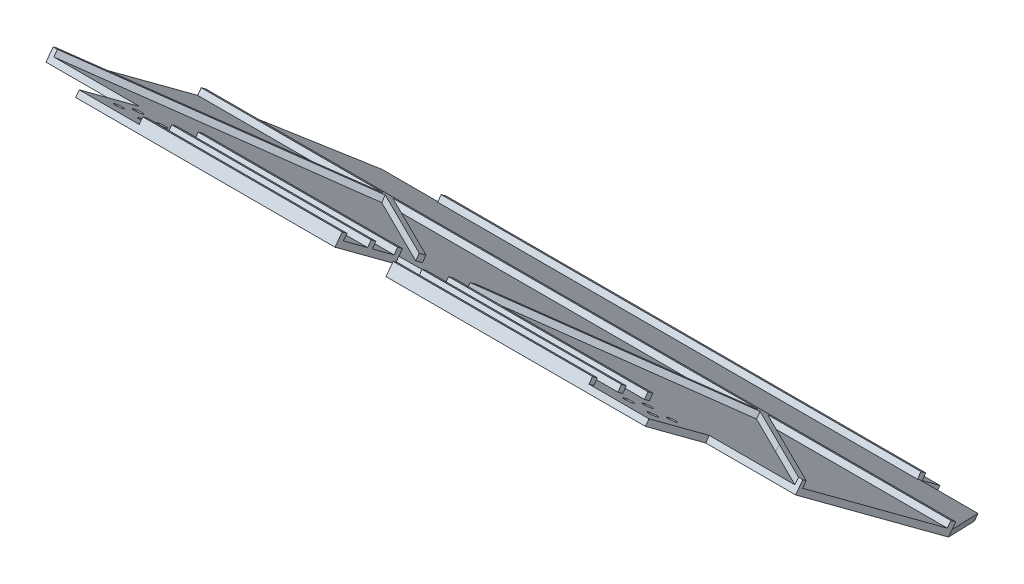
from build123d import *

# Parameters (mm, degrees)
SHELL_2_T            = -3
SKETCH_4_R           = 1.5
CUT_EXTRUDE_1_DEPTH  = 10
EXTRUDE_1_DEPTH      = 40.5
SKETCH_7_R           = 1.51
CUT_EXTRUDE_2_DEPTH  = 100
SKETCH_8_R           = 1.5
EXTRUDE_2_DEPTH      = 3
EXTRUDE_3_DEPTH      = 4
SKETCH_11_W          = 56.2
SKETCH_11_H          = 25
CUT_EXTRUDE_3_DEPTH  = 4
SKETCH_12_W          = 3
SKETCH_12_H          = 215
EXTRUDE_5_DEPTH      = 10
SKETCH_13_W          = 10
SKETCH_13_H          = 215
CUT_EXTRUDE_4_DEPTH  = 300
SKETCH_15_W          = 116.702064096
SKETCH_15_H          = 65.174269722
SKETCH_15_W_2        = 111.85
SKETCH_15_H_2        = 80
CUT_EXTRUDE_5_DEPTH  = 4
EXTRUDE_6_DEPTH      = 4
SKETCH_17_W          = 56.2
SKETCH_17_H          = 25
CUT_EXTRUDE_6_DEPTH  = 4
EXTRUDE_7_DEPTH      = 4
SKETCH_20_R          = 1.5
CUT_EXTRUDE_7_DEPTH  = 10
SKETCH_21_W          = 185
SKETCH_21_H          = 185
CUT_EXTRUDE_8_DEPTH  = 37.5
EXTRUDE_START        = 1
SKETCH_22_W          = 185
SKETCH_22_H          = 185
SKETCH_22_R          = 1.5
EXTRUDE_8_DEPTH      = 1
CUT_EXTRUDE_START    = -2
SKETCH_24_R          = 3
SKETCH_24_R_2        = 1.5
CUT_EXTRUDE_9_DEPTH  = 2
SKETCH_25_R          = 1.51
CUT_EXTRUDE_10_DEPTH = 10
SKETCH_26_R          = 1.5
EXTRUDE_9_DEPTH      = 4
EXTRUDE_START_2      = -4
SKETCH_28_R          = 3
EXTRUDE_10_DEPTH     = 4
SKETCH_29_R          = 3
CUT_EXTRUDE_11_DEPTH = 2
SKETCH_30_W          = 20
SKETCH_30_H          = 20
EXTRUDE_11_DEPTH     = 300
EXTRUDE_11_2_DEPTH   = 300
EXTRUDE_11_3_DEPTH   = 300
EXTRUDE_11_4_DEPTH   = 300
SKETCH_31_W          = 20
SKETCH_31_H          = 20
EXTRUDE_12_DEPTH     = 300
EXTRUDE_13_DEPTH     = 2
EXTRUDE_14_DEPTH     = 2
SKETCH_34_W          = 360
SKETCH_34_H          = 2
EXTRUDE_15_DEPTH     = 40
CUT_EXTRUDE_12_DEPTH = 400
SKETCH_36_W          = 360
SKETCH_36_H          = 35.328815684
CUT_EXTRUDE_13_DEPTH = 1
SKETCH_38_W          = 80
SKETCH_38_H          = 33.975155378
CUT_EXTRUDE_16_DEPTH = 3
SKETCH_40_R          = 1.5
CUT_EXTRUDE_17_DEPTH = 3
CUT_EXTRUDE_18_DEPTH = 3
SKETCH_42_W          = 20
SKETCH_42_H          = 20
SKETCH_42_W_2        = 200
SKETCH_42_H_2        = 194.4594667
CUT_EXTRUDE_19_DEPTH = 1000
SKETCH_43_W          = 200
SKETCH_43_H          = 10.011542291
CUT_EXTRUDE_20_DEPTH = 1000
SKETCH_44_W          = 5
SKETCH_44_H          = 25
CUT_EXTRUDE_21_DEPTH = 5
SKETCH_46_W          = 190
SKETCH_46_H          = 2
EXTRUDE_16_DEPTH     = 2
SKETCH_47_W          = 20
SKETCH_47_H          = 25
CUT_EXTRUDE_22_DEPTH = 2
SKETCH_48_W          = 250
SKETCH_48_H          = 2
EXTRUDE_17_DEPTH     = 2
EXTRUDE_18_DEPTH     = 2
CUT_EXTRUDE_23_DEPTH = 10
CUT_EXTRUDE_24_DEPTH = 10
CUT_EXTRUDE_25_DEPTH = 2
CUT_EXTRUDE_26_DEPTH = 2


with BuildPart() as part:
    # 草图3 → 放样1 section 0
    with BuildSketch(Plane.XY.offset(20)):
        with BuildLine():
            Line((-32.460246779, 32.274755465), (182.539753221, 32.274755465))
            Line((182.539753221, 32.274755465), (182.539753221, -182.725244535))
            Line((182.539753221, -182.725244535), (-32.460246779, -182.725244535))
            Line((-32.460246779, -182.725244535), (-32.460246779, 32.274755465))
        make_face()
    # 草图1 → 放样1 section 1
    with BuildSketch(Plane.XY):
        with BuildLine():
            Line((-17.5, -167.5), (167.5, -167.5))
            Line((167.5, -167.5), (167.5, 17.5))
            Line((167.5, 17.5), (-17.5, 17.5))
            Line((-17.5, 17.5), (-17.5, -167.5))
        make_face()
    loft()

    # 抽壳2
    shell_2_openings = [part.faces().sort_by_distance(p)[0] for p in [
        (75.039753221, -75.225244535, 20),
    ]]
    offset(amount=SHELL_2_T, openings=shell_2_openings, kind=Kind.INTERSECTION)

    # 草图4 → 切除-拉伸1 (cut)
    with BuildSketch(Plane.XY.offset(3)):
        with Locations((47.75, -75.225244535)):
            Circle(SKETCH_4_R)
        with Locations((84.75, -75.225244535)):
            Circle(SKETCH_4_R)
        with Locations((73.25, -75.225244535)):
            Circle(SKETCH_4_R)
        with Locations((59.25, -75.225244535)):
            Circle(SKETCH_4_R)
        with Locations((66.25, -68.225244535)):
            Circle(SKETCH_4_R)
        with Locations((66.25, -82.225244535)):
            Circle(SKETCH_4_R)
    extrude(amount=-CUT_EXTRUDE_1_DEPTH, mode=Mode.SUBTRACT)

    # 草图6 → 凸台-拉伸1 (add)
    with BuildSketch(Plane.XY.offset(3)):
        Polygon((38.15, -62.5), (34.15, -62.5), (31.15, -62.5), (31.15, -65.5), (34.15, -65.5), (34.15, -84.5), (31.15, -84.5), (31.15, -87.5), (34.15, -87.5), (38.15, -87.5), (38.15, -75), align=None)
        Polygon((94.35, -75), (94.35, -62.5), (98.35, -62.5), (101.35, -62.5), (101.35, -65.5), (98.35, -65.5), (98.35, -84.5), (101.35, -84.5), (101.35, -87.5), (98.35, -87.5), (94.35, -87.5), align=None)
    extrude(amount=-EXTRUDE_1_DEPTH)

    # 草图7 → 切除-拉伸2 (cut)
    with BuildSketch(Plane(origin=(98.35, 0, 0), x_dir=(0, 0, -1), z_dir=(1, 0, 0))):
        with Locations((16.5, -75)):
            Circle(SKETCH_7_R)
        with Locations((33.5, -75)):
            Circle(SKETCH_7_R)
    extrude(amount=-CUT_EXTRUDE_2_DEPTH, mode=Mode.SUBTRACT)

    # 草图8 → 凸台-拉伸2 (add)
    with BuildSketch(Plane.XY.offset(3)):
        with Locations((66.25, -68.225244535)):
            Circle(SKETCH_8_R)
        with Locations((59.25, -75.225244535)):
            Circle(SKETCH_8_R)
        with Locations((47.75, -75.225244535)):
            Circle(SKETCH_8_R)
        with Locations((73.25, -75.225244535)):
            Circle(SKETCH_8_R)
        with Locations((84.75, -75.225244535)):
            Circle(SKETCH_8_R)
        with Locations((66.25, -82.225244535)):
            Circle(SKETCH_8_R)
    extrude(amount=-EXTRUDE_2_DEPTH)

    # 草图9 → 凸台-拉伸3 (add)
    with BuildSketch(Plane(origin=(0, 0, 0), x_dir=(-1, 0, 0), z_dir=(0, 0, -1))):
        Polygon((-73.585786438, -76.414213562), (0, -2.828427125), (0, 0), (-2.828427125, 0), (-72.748638048, -69.920210924), (-150, -147.171572875), (-150, -150), (-147.171572875, -150), align=None)
    extrude(amount=EXTRUDE_3_DEPTH)

    # 草图11 → 切除-拉伸3 (cut)
    with BuildSketch(Plane(origin=(0, 0, -4), x_dir=(-1, 0, 0), z_dir=(0, 0, -1))):
        with Locations((-66.25, -75)):
            Rectangle(SKETCH_11_W, SKETCH_11_H)
    extrude(amount=-CUT_EXTRUDE_3_DEPTH, mode=Mode.SUBTRACT)


with BuildPart() as body_2:
    # 草图12 → 凸台-拉伸5 (new body)
    with BuildSketch(Plane.XY.offset(20)):
        with Locations((184.039753221, -75.225244535)):
            Rectangle(SKETCH_12_W, SKETCH_12_H)
    extrude(amount=-EXTRUDE_5_DEPTH)


with BuildPart() as cut_extrude_4_tool:
    # 草图13 → 切除-拉伸4 (new body)
    with BuildSketch(Plane(origin=(185.539753221, 0, 0), x_dir=(0, 0, -1), z_dir=(1, 0, 0))):
        with Locations((-15, -75.225244535)):
            Rectangle(SKETCH_13_W, SKETCH_13_H)
    extrude(amount=-CUT_EXTRUDE_4_DEPTH)


with BuildPart() as part_1:
    add(part.part)

    # 切除-拉伸4: cut by cut_extrude_4_tool
    add(cut_extrude_4_tool.part, mode=Mode.SUBTRACT)

    # 草图15 → 切除-拉伸5 (cut)
    with BuildSketch(Plane(origin=(0, 0, -4), x_dir=(-1, 0, 0), z_dir=(0, 0, -1))):
        with Locations((-96.501032048, -120.087134861)):
            Rectangle(SKETCH_15_W, SKETCH_15_H)
        with Locations((-38.425, -22.5)):
            Rectangle(SKETCH_15_W_2, SKETCH_15_H_2)
    extrude(amount=-CUT_EXTRUDE_5_DEPTH, mode=Mode.SUBTRACT)

    # 草图16 → 凸台-拉伸6 (add)
    with BuildSketch(Plane(origin=(0, 0, 0), x_dir=(-1, 0, 0), z_dir=(0, 0, -1))):
        Polygon((-77.828427125, -75), (-167.5, -164.671572875), (-167.5, -167.5), (-164.671572875, -167.5), (-75, -77.828427125), (14.671572875, -167.5), (17.5, -167.5), (17.5, -164.671572875), (-72.171572875, -75), (17.5, 14.671572875), (17.5, 17.5), (14.671572875, 17.5), (-75, -72.171572875), (-164.671572875, 17.5), (-167.5, 17.5), (-167.5, 14.671572875), align=None)
    extrude(amount=EXTRUDE_6_DEPTH)

    # 草图17 → 切除-拉伸6 (cut)
    with BuildSketch(Plane(origin=(0, 0, 0), x_dir=(-1, 0, 0), z_dir=(0, 0, -1))):
        with Locations((-66.25, -75)):
            Rectangle(SKETCH_17_W, SKETCH_17_H)
    extrude(amount=CUT_EXTRUDE_6_DEPTH, mode=Mode.SUBTRACT)

    # 草图18 → 凸台-拉伸7 (add)
    with BuildSketch(Plane(origin=(0, 0, 0), x_dir=(-1, 0, 0), z_dir=(0, 0, -1))):
        Polygon((-75, -119.25), (-33.578427125, -119.25), (-31.578427125, -121.25), (-29.578427125, -123.25), (-75, -123.25), (-120.421572875, -123.25), (-116.421572875, -119.25), align=None)
        Polygon((-119.25, -75), (-119.25, -116.421572875), (-121.25, -118.421572875), (-123.25, -120.421572875), (-123.25, -75), (-123.25, -29.578427125), (-119.25, -33.578427125), align=None)
        Polygon((-75, -30.75), (-116.421572875, -30.75), (-120.421572875, -26.75), (-75, -26.75), (-29.578427125, -26.75), (-33.578427125, -30.75), align=None)
        Polygon((-30.75, -33.578427125), (-26.75, -29.578427125), (-26.75, -75), (-26.75, -120.421572875), (-30.75, -116.421572875), (-30.75, -75), align=None)
    extrude(amount=EXTRUDE_7_DEPTH)

    # 草图20 → 切除-拉伸7 (cut)
    with BuildSketch(Plane(origin=(0, 0, 0), x_dir=(-1, 0, 0), z_dir=(0, 0, -1))):
        with Locations((-66.25, -82)):
            Circle(SKETCH_20_R)
        with Locations((-47.75, -75)):
            Circle(SKETCH_20_R)
        with Locations((-84.75, -75)):
            Circle(SKETCH_20_R)
        with Locations((-66.25, -68)):
            Circle(SKETCH_20_R)
    extrude(amount=-CUT_EXTRUDE_7_DEPTH, mode=Mode.SUBTRACT)

    # 草图21 → 切除-拉伸8 (cut)
    with BuildSketch(Plane(origin=(0, 0, -37.5), x_dir=(-1, 0, 0), z_dir=(0, 0, -1))):
        with Locations((-75, -75)):
            Rectangle(SKETCH_21_W, SKETCH_21_H)
    extrude(amount=-CUT_EXTRUDE_8_DEPTH, mode=Mode.SUBTRACT)

    # 草图22 → 凸台-拉伸8 (add)
    with BuildSketch(Plane(origin=(0, 0, 0), x_dir=(-1, 0, 0), z_dir=(0, 0, -1)).offset(EXTRUDE_START)):
        with Locations((-75, -75)):
            Rectangle(SKETCH_22_W, SKETCH_22_H)
        with Locations((-66.25, -68)):
            Circle(SKETCH_22_R, mode=Mode.SUBTRACT)
        with Locations((-66.25, -82)):
            Circle(SKETCH_22_R, mode=Mode.SUBTRACT)
        with Locations((-84.75, -75)):
            Circle(SKETCH_22_R, mode=Mode.SUBTRACT)
        with Locations((-47.75, -75)):
            Circle(SKETCH_22_R, mode=Mode.SUBTRACT)
    extrude(amount=-EXTRUDE_8_DEPTH)

    # 草图24 → 切除-拉伸9 (cut)
    # profile 1 of 4: a face of its own
    with BuildSketch(Plane.XY.offset(3).offset(CUT_EXTRUDE_START)):
        with Locations((66.25, -68)):
            Circle(SKETCH_24_R)
        with Locations((66.25, -68)):
            Circle(SKETCH_24_R_2, mode=Mode.SUBTRACT)
    # profile 2 of 4: a face of its own
    with BuildSketch(Plane.XY.offset(3).offset(CUT_EXTRUDE_START)):
        with Locations((66.25, -82)):
            Circle(SKETCH_24_R)
        with Locations((66.25, -82)):
            Circle(SKETCH_24_R_2, mode=Mode.SUBTRACT)
    # profile 3 of 4: a face of its own
    with BuildSketch(Plane.XY.offset(3).offset(CUT_EXTRUDE_START)):
        with Locations((47.75, -75)):
            Circle(SKETCH_24_R)
    # profile 4 of 4: a face of its own
    with BuildSketch(Plane.XY.offset(3).offset(CUT_EXTRUDE_START)):
        with Locations((84.75, -75)):
            Circle(SKETCH_24_R)
        with Locations((84.75, -75)):
            Circle(SKETCH_24_R_2, mode=Mode.SUBTRACT)
    extrude(amount=CUT_EXTRUDE_9_DEPTH, mode=Mode.SUBTRACT)

    # 草图25 → 切除-拉伸10 (cut)
    with BuildSketch(Plane(origin=(0, 0, -1), x_dir=(-1, 0, 0), z_dir=(0, 0, -1))):
        with Locations((-75, -68)):
            Circle(SKETCH_25_R)
        with Locations((-75, -82)):
            Circle(SKETCH_25_R)
        with Locations((-56.5, -75)):
            Circle(SKETCH_25_R)
        with Locations((-93.5, -75)):
            Circle(SKETCH_25_R)
    extrude(amount=-CUT_EXTRUDE_10_DEPTH, mode=Mode.SUBTRACT)

    # 草图26 → 凸台-拉伸9 (add)
    with BuildSketch(Plane(origin=(0, 0, -1), x_dir=(-1, 0, 0), z_dir=(0, 0, -1))):
        with Locations((-84.75, -75)):
            Circle(SKETCH_26_R)
        with Locations((-66.25, -68)):
            Circle(SKETCH_26_R)
        with Locations((-66.25, -82)):
            Circle(SKETCH_26_R)
        with Locations((-47.75, -75)):
            Circle(SKETCH_26_R)
    extrude(amount=-EXTRUDE_9_DEPTH)

    # 草图28 → 凸台-拉伸10 (add)
    with BuildSketch(Plane.XY.offset(3).offset(EXTRUDE_START_2)):
        with Locations((84.75, -75)):
            Circle(SKETCH_28_R)
        with Locations((66.25, -68)):
            Circle(SKETCH_28_R)
        with Locations((47.75, -75)):
            Circle(SKETCH_28_R)
        with Locations((66.25, -82)):
            Circle(SKETCH_28_R)
    extrude(amount=EXTRUDE_10_DEPTH)

    # 草图29 → 切除-拉伸11 (cut)
    with BuildSketch(Plane.XY.offset(3)):
        with Locations((75, -68)):
            Circle(SKETCH_29_R)
        with Locations((75, -82)):
            Circle(SKETCH_29_R)
        with Locations((93.5, -75)):
            Circle(SKETCH_29_R)
        with Locations((56.5, -75)):
            Circle(SKETCH_29_R)
    extrude(amount=-CUT_EXTRUDE_11_DEPTH, mode=Mode.SUBTRACT)

    # 草图32 → 凸台-拉伸13 (add)
    with BuildSketch(Plane(origin=(0, 11.321485901, -8.363609284), x_dir=(1, 0, 0), z_dir=(0, 0.804327079908719, -0.5941867959871823))):
        Polygon((-24.98012339, -22.831022035), (-19.370030847, -13.506457206), (169.379969153, -13.506457206), (175.01987661, -22.831022035), (255.01987661, -155.799450038), (-104.98012339, -155.799450038), align=None)
    extrude(amount=EXTRUDE_13_DEPTH)

    # 草图33 → 凸台-拉伸14 (add)
    with BuildSketch(Plane(origin=(0, 12.930140061, -9.551982876), x_dir=(1, 0, 0), z_dir=(0, 0.8043270799087189, -0.5941867959871823))):
        Polygon((-24.98012339, -22.831022035), (175.01987661, -22.831022035), (173.810188531, -20.831022035), (170.159993158, -20.831022035), (-23.776830229, -20.831022035), align=None)
    extrude(amount=EXTRUDE_14_DEPTH)



with BuildPart() as body_2_1:
    add(body_2.part)

    # 切除-拉伸4: cut by cut_extrude_4_tool
    add(cut_extrude_4_tool.part, mode=Mode.SUBTRACT)


with BuildPart() as body_2_2:
    # 草图30 → 凸台-拉伸11 (new body)
    with BuildSketch(Plane.XY.offset(10)):
        with Locations((-114.98012339, 114.887377733)):
            Rectangle(SKETCH_30_W, SKETCH_30_H)
    extrude(amount=EXTRUDE_11_DEPTH)



with BuildPart() as body_3:
    # 草图30 → Extrude 11 2 (new body)
    with BuildSketch(Plane.XY.offset(10)):
        with Locations((265.01987661, 114.887377733)):
            Rectangle(SKETCH_30_W, SKETCH_30_H)
    extrude(amount=EXTRUDE_11_2_DEPTH)


with BuildPart() as body_4:
    # 草图30 → Extrude 11 3 (new body)
    with BuildSketch(Plane.XY.offset(10)):
        with Locations((-114.98012339, -265.112622267)):
            Rectangle(SKETCH_30_W, SKETCH_30_H)
    extrude(amount=EXTRUDE_11_3_DEPTH)


with BuildPart() as body_5:
    # 草图30 → Extrude 11 4 (new body)
    with BuildSketch(Plane.XY.offset(10)):
        with Locations((265.01987661, -265.112622267)):
            Rectangle(SKETCH_30_W, SKETCH_30_H)
    extrude(amount=EXTRUDE_11_4_DEPTH)


with BuildPart() as body_2_2_1:
    add(body_2_2.part)

    add(body_3.part)  # 凸台-拉伸12 merges body 3

    add(body_4.part)  # 凸台-拉伸12 merges body 4

    add(body_5.part)  # 凸台-拉伸12 merges body 5
    # 草图31 → 凸台-拉伸12 (add)
    with BuildSketch(Plane(origin=(0, 0, 10), x_dir=(-1, 0, 0), z_dir=(0, 0, -1))):
        with Locations((-265.01987661, 114.887377733)):
            Rectangle(SKETCH_31_W, SKETCH_31_H)
        with Locations((114.98012339, 114.887377733)):
            Rectangle(SKETCH_31_W, SKETCH_31_H)
        with Locations((114.98012339, -265.112622267)):
            Rectangle(SKETCH_31_W, SKETCH_31_H)
        with Locations((-265.01987661, -265.112622267)):
            Rectangle(SKETCH_31_W, SKETCH_31_H)
    extrude(amount=EXTRUDE_12_DEPTH)


with BuildPart() as part_2:
    add(part_1.part)

    add(body_2_2_1.part)  # 凸台-拉伸15 merges body 2 2
    # 草图34 → 凸台-拉伸15 (add)
    with BuildSketch(Plane(origin=(0, 92.573976034, 125.3137167), x_dir=(1, 0, 0), z_dir=(0, 0.5941867959871824, 0.8043270799087189))):
        with Locations((75.01987661, 15.075723898)):
            Rectangle(SKETCH_34_W, SKETCH_34_H)
    extrude(amount=EXTRUDE_15_DEPTH)

    # 草图35 → 切除-拉伸12 (cut)
    with BuildSketch(Plane(origin=(255.01987661, 0, 0), x_dir=(0, 0, -1), z_dir=(1, 0, 0))):
        Polygon((-149.123190612, 127.662933775), (-145.366030572, 124.887377733), (-142.000085698, 124.887377733), (-147.93481702, 129.271587935), align=None)
    extrude(amount=-CUT_EXTRUDE_12_DEPTH, mode=Mode.SUBTRACT)

    # 草图36 → 切除-拉伸13 (cut)
    with BuildSketch(Plane(origin=(0, 11.321485901, -8.363609284), x_dir=(1, 0, 0), z_dir=(0, -0.8043270799087189, 0.5941867959871824))):
        with Locations((75.01987661, 173.46385788)):
            Rectangle(SKETCH_36_W, SKETCH_36_H)
    extrude(amount=-CUT_EXTRUDE_13_DEPTH, mode=Mode.SUBTRACT)

    # 草图38 → 切除-拉伸16 (cut)
    with BuildSketch(Plane(origin=(0, 12.930140061, -9.551982876), x_dir=(1, 0, 0), z_dir=(0, 0.8043270799087189, -0.5941867959871824))):
        with Locations((-64.98012339, -172.787027727)):
            Rectangle(SKETCH_38_W, SKETCH_38_H)
        with Locations((215.01987661, -172.787027727)):
            Rectangle(SKETCH_38_W, SKETCH_38_H)
    extrude(amount=-CUT_EXTRUDE_16_DEPTH, mode=Mode.SUBTRACT)

    # 草图40 → 切除-拉伸17 (cut)
    with BuildSketch(Plane(origin=(0, 11.321485901, -8.363609284), x_dir=(1, 0, 0), z_dir=(0, -0.8043270799087189, 0.5941867959871824))):
        Polygon((-24.98012339, 189.774605416), (-24.98012339, 155.799450038), (-104.98012339, 155.799450038), (-104.98012339, 127.787027727), (-24.98012339, 127.787027727), (-24.98012339, 152.787027727), (175.01987661, 152.787027727), (175.01987661, 127.787027727), (255.01987661, 127.787027727), (255.01987661, 155.799450038), (175.01987661, 155.799450038), (175.01987661, 189.774605416), align=None)
        with Locations((156.01987661, 143.787027727)):
            Circle(SKETCH_40_R)
        with Locations((164.01987661, 143.787027727)):
            Circle(SKETCH_40_R)
        with Locations((164.01987661, 135.787027727)):
            Circle(SKETCH_40_R)
        with Locations((156.01987661, 135.787027727)):
            Circle(SKETCH_40_R)
        with Locations((-13.98012339, 143.787027727)):
            Circle(SKETCH_40_R)
        with Locations((-5.98012339, 143.787027727)):
            Circle(SKETCH_40_R)
        with Locations((-13.98012339, 135.787027727)):
            Circle(SKETCH_40_R)
        with Locations((-5.98012339, 135.787027727)):
            Circle(SKETCH_40_R)
    extrude(amount=-CUT_EXTRUDE_17_DEPTH, mode=Mode.SUBTRACT)

    # 草图41 → 切除-拉伸18 (cut)
    with BuildSketch(Plane(origin=(0, 11.321485901, -8.363609284), x_dir=(-1, 0, 0), z_dir=(0, -0.8043270799087189, 0.5941867959871824))):
        Polygon((88.1265453, -127.787027727), (49.98012339, -64.383655786), (49.98012339, -127.787027727), align=None)
        Polygon((-200.01987661, -127.787027727), (-200.01987661, -64.383655786), (-238.16629852, -127.787027727), align=None)
    extrude(amount=-CUT_EXTRUDE_18_DEPTH, mode=Mode.SUBTRACT)

    # 草图42 → 切除-拉伸19 (cut)
    with BuildSketch(Plane(origin=(0, 0, -290), x_dir=(-1, 0, 0), z_dir=(0, 0, -1))):
        with Locations((-265.01987661, 114.887377733)):
            Rectangle(SKETCH_42_W, SKETCH_42_H)
        with Locations((-265.01987661, -265.112622267)):
            Rectangle(SKETCH_42_W, SKETCH_42_H)
        with Locations((114.98012339, -265.112622267)):
            Rectangle(SKETCH_42_W, SKETCH_42_H)
        with Locations((114.98012339, 114.887377733)):
            Rectangle(SKETCH_42_W, SKETCH_42_H)
        with Locations((-75.01987661, -77.882888917)):
            Rectangle(SKETCH_42_W_2, SKETCH_42_H_2)
    extrude(amount=-CUT_EXTRUDE_19_DEPTH, mode=Mode.SUBTRACT)

    # 草图43 → 切除-拉伸20 (cut)
    with BuildSketch(Plane(origin=(0, 11.321485901, -8.363609284), x_dir=(1, 0, 0), z_dir=(0, -0.8043270799087189, 0.5941867959871824))):
        with Locations((75.01987661, 17.82525089)):
            Rectangle(SKETCH_43_W, SKETCH_43_H)
    extrude(amount=CUT_EXTRUDE_20_DEPTH, mode=Mode.SUBTRACT)

    # 草图44 → 切除-拉伸21 (cut)
    with BuildSketch(Plane(origin=(0, 11.321485901, -8.363609284), x_dir=(1, 0, 0), z_dir=(0, -0.8043270799087189, 0.5941867959871824))):
        with Locations((-22.48012339, 140.287027727)):
            Rectangle(SKETCH_44_W, SKETCH_44_H)
        with Locations((172.51987661, 140.287027727)):
            Rectangle(SKETCH_44_W, SKETCH_44_H)
    extrude(amount=-CUT_EXTRUDE_21_DEPTH, mode=Mode.SUBTRACT)

    # 草图46 → 凸台-拉伸16 (add)
    with BuildSketch(Plane(origin=(0, 12.930140061, -9.551982876), x_dir=(1, 0, 0), z_dir=(0, 0.8043270799087189, -0.5941867959871824))):
        with Locations((75.01987661, -151.787027727)):
            Rectangle(SKETCH_46_W, SKETCH_46_H)
        with Locations((75.01987661, -139.787027727)):
            Rectangle(SKETCH_46_W, SKETCH_46_H)
        with Locations((75.01987661, -128.787027727)):
            Rectangle(SKETCH_46_W, SKETCH_46_H)
    extrude(amount=EXTRUDE_16_DEPTH)

    # 草图47 → 切除-拉伸22 (cut)
    with BuildSketch(Plane(origin=(0, 12.930140061, -9.551982876), x_dir=(1, 0, 0), z_dir=(0, 0.8043270799087189, -0.5941867959871824))):
        with Locations((-9.98012339, -140.287027727)):
            Rectangle(SKETCH_47_W, SKETCH_47_H)
        with Locations((160.01987661, -140.287027727)):
            Rectangle(SKETCH_47_W, SKETCH_47_H)
    extrude(amount=CUT_EXTRUDE_22_DEPTH, mode=Mode.SUBTRACT)

    # 草图48 → 凸台-拉伸17 (add)
    with BuildSketch(Plane(origin=(0, 12.930140061, -9.551982876), x_dir=(1, 0, 0), z_dir=(0, 0.8043270799087189, -0.5941867959871824))):
        with Locations((75.01987661, -65.383655786)):
            Rectangle(SKETCH_48_W, SKETCH_48_H)
    extrude(amount=EXTRUDE_17_DEPTH)

    # 草图49 → 凸台-拉伸18 (add)
    with BuildSketch(Plane(origin=(0, 12.930140061, -9.551982876), x_dir=(1, 0, 0), z_dir=(0, 0.8043270799087189, -0.5941867959871824))):
        Polygon((-48.553225432, -127.787027727), (12.51987661, -67.785517321), (73.592978653, -127.787027727), (76.446665315, -127.787027727), (137.519927552, -67.785464823), (168.069055648, -97.798678968), (198.592978653, -127.787027727), (200.01987661, -127.787027727), (200.01987661, -126.385166191), (138.946774568, -66.383655786), (136.093087905, -66.383655786), (75.019825669, -126.385218689), (44.470697573, -96.372004544), (13.946774568, -66.383655786), (11.092978653, -66.383655786), (-49.98012339, -126.385166191), (-49.98012339, -127.787027727), align=None)
    extrude(amount=EXTRUDE_18_DEPTH)

    # 草图50 → 切除-拉伸23 (cut)
    with BuildSketch(Plane(origin=(0, 11.321485901, -8.363609284), x_dir=(1, 0, 0), z_dir=(0, -0.8043270799087189, 0.5941867959871824))):
        Polygon((75.01987661, 152.787027727), (83.51987661, 152.787027727), (83.51987661, 127.787027727), (66.51987661, 127.787027727), (66.51987661, 152.787027727), align=None)
    extrude(amount=-CUT_EXTRUDE_23_DEPTH, mode=Mode.SUBTRACT)

    # 草图51 → 切除-拉伸24 (cut)
    with BuildSketch(Plane(origin=(0, 12.930140061, -9.551982876), x_dir=(1, 0, 0), z_dir=(0, 0.8043270799087189, -0.5941867959871824))):
        Polygon((66.51987661, -127.787027727), (66.51987661, -118.034381621), (75.019825669, -126.385218689), (83.51987661, -118.034324655), (83.51987661, -127.787027727), align=None)
    extrude(amount=CUT_EXTRUDE_24_DEPTH, mode=Mode.SUBTRACT)

    # 草图52 → 切除-拉伸25 (cut)
    with BuildSketch(Plane(origin=(0, 14.53879422, -10.740356468), x_dir=(1, 0, 0), z_dir=(-2.761171813339654e-15, 0.8043270799087192, -0.5941867959871818))):
        Polygon((-24.98012339, -22.831022035), (-4.98012339, -22.831022035), (-4.98012339, -20.831022035), (-23.776830229, -20.831022035), align=None)
        Polygon((175.01987661, -22.831022035), (155.01987661, -22.831022035), (155.01987661, -20.831022035), (173.810188531, -20.831022035), align=None)
    extrude(amount=-CUT_EXTRUDE_25_DEPTH, mode=Mode.SUBTRACT)

    # 草图53 → 切除-拉伸26 (cut)
    with BuildSketch(Plane(origin=(0, 12.930140061, -9.551982876), x_dir=(1, 0, 0), z_dir=(0, 0.8043270799087189, -0.5941867959871823))):
        Polygon((155.01987661, -21.831022035), (174.415032571, -21.831022035), (169.379969153, -13.506457206), (155.01987661, -13.506457206), align=None)
        Polygon((-4.98012339, -21.831022035), (-24.378476809, -21.831022035), (-19.370030847, -13.506457206), (-4.98012339, -13.506457206), align=None)
    extrude(amount=-CUT_EXTRUDE_26_DEPTH, mode=Mode.SUBTRACT)


solid = part_2.part
